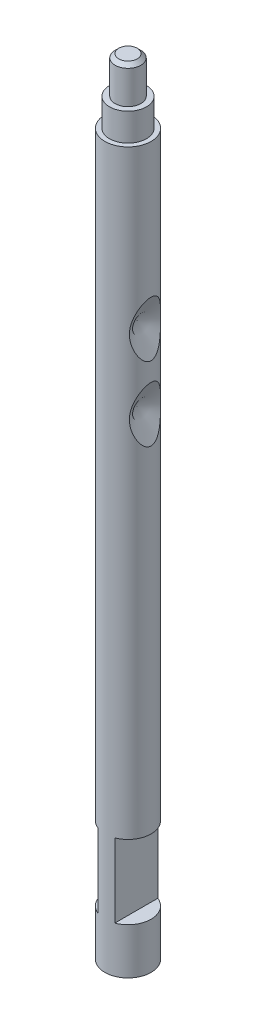
from build123d import *

# Parameters (mm, degrees)
SKETCH1_R               = 1.25
BOSS_EXTRUDE1_DEPTH     = 42.5
SKETCH2_OUTSIDE_W       = 13.03
SKETCH2_OUTSIDE_H       = 13.03
SKETCH2_OUTSIDE_R       = 1
CUT_EXTRUDE1_DEPTH      = 3.5
SKETCH3_OUTSIDE_W       = 13.03
SKETCH3_OUTSIDE_H       = 13.03
SKETCH3_OUTSIDE_R       = 0.7
CUT_EXTRUDE2_DEPTH      = 2
CHAMFER1_SIZE           = 0.2
CUT_EXTRUDE3_DEPTH      = 43.536748818
CUT_EXTRUDE3_DEPTH_BACK = 43.536748818
SKETCH4_W               = 0.8
SKETCH4_H               = 4
LPATTERN1_COUNT         = 2
LPATTERN1_PITCH         = 4


with BuildPart() as part:
    # Sketch1 → Boss-Extrude1 (new body)
    with BuildSketch(Plane(origin=(0, 0, 0), x_dir=(1, 0, 0), z_dir=(0, 1, 0))):
        Circle(SKETCH1_R)
    extrude(amount=BOSS_EXTRUDE1_DEPTH)

    # Sketch2 outside → Cut-Extrude1 (cut)
    with BuildSketch(Plane(origin=(0, 42.5, 0), x_dir=(1, 0, 0), z_dir=(0, 1, 0))):
        Rectangle(SKETCH2_OUTSIDE_W, SKETCH2_OUTSIDE_H)
        Circle(SKETCH2_OUTSIDE_R, mode=Mode.SUBTRACT)
    extrude(amount=-CUT_EXTRUDE1_DEPTH, mode=Mode.SUBTRACT)

    # Sketch3 outside → Cut-Extrude2 (cut)
    with BuildSketch(Plane(origin=(0, 42.5, 0), x_dir=(1, 0, 0), z_dir=(0, 1, 0))):
        Rectangle(SKETCH3_OUTSIDE_W, SKETCH3_OUTSIDE_H)
        Circle(SKETCH3_OUTSIDE_R, mode=Mode.SUBTRACT)
    extrude(amount=-CUT_EXTRUDE2_DEPTH, mode=Mode.SUBTRACT)

    # Chamfer1
    chamfer1_edges = [part.edges().sort_by_distance(p)[0] for p in [
        (-0.7, 42.5, 0),
    ]]
    chamfer(chamfer1_edges, length=CHAMFER1_SIZE)

    # Sketch4 → Cut-Extrude3 (cut, two sides: drawn at the far end of the back side and taken through both)
    with BuildSketch(Plane.XY.offset(-CUT_EXTRUDE3_DEPTH_BACK)):
        with Locations((0.85, 4.5)):
            Rectangle(SKETCH4_W, SKETCH4_H)
        with Locations((-0.85, 4.5)):
            Rectangle(SKETCH4_W, SKETCH4_H)
    extrude(amount=CUT_EXTRUDE3_DEPTH + CUT_EXTRUDE3_DEPTH_BACK, mode=Mode.SUBTRACT)

    # Sketch5 → Cut-Revolve2 (revolve, cut)
    with BuildSketch(Plane.XY):
        Polygon((1.25, 31.691583984), (0.49, 30.2), (1.25, 30.2), align=None)
    cut_revolve2 = revolve(axis=Axis((0.49, 30.2, 0), (1, 0, 0)), mode=Mode.SUBTRACT)

    # LPattern1: Cut-Revolve2 ×2
    with Locations(*[(0, -i * LPATTERN1_PITCH, 0) for i in range(1, LPATTERN1_COUNT)]):
        add(cut_revolve2, mode=Mode.SUBTRACT)


solid = part.part
